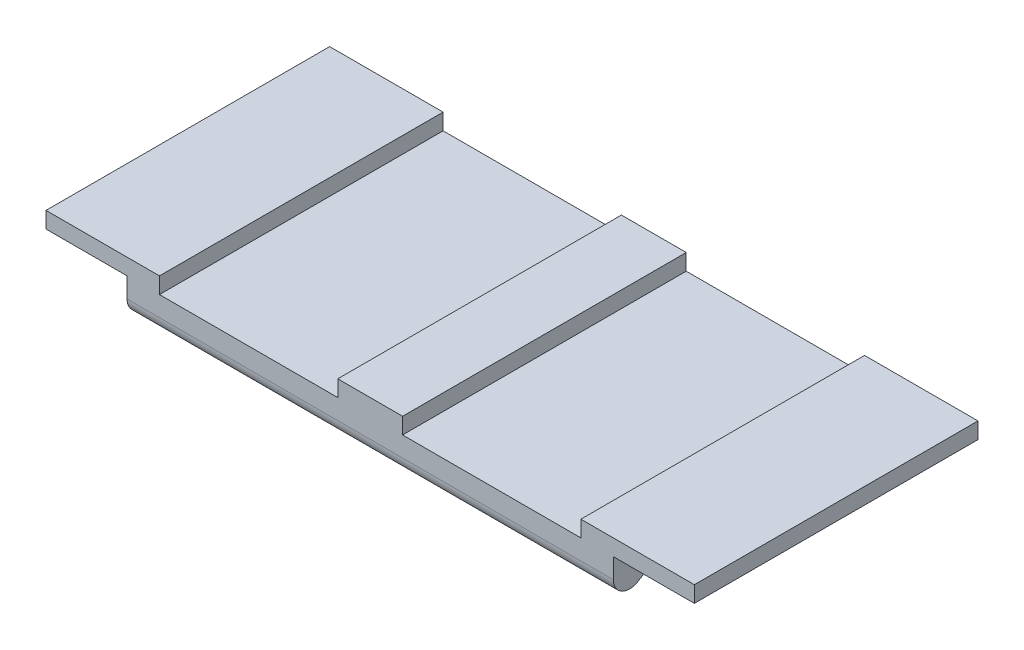
from build123d import *

# Parameters (mm, degrees)
SKETCH1_W               = 60
SKETCH1_H               = 35
BOSS_EXTRUDE1_DEPTH     = 8
CUT_EXTRUDE1_DEPTH      = 64.009919854
CUT_EXTRUDE1_DEPTH_BACK = 64.009919854
FILLET1_R               = 2
SKETCH3_W               = 22
SKETCH3_H               = 2
CUT_EXTRUDE2_DEPTH      = 47.549222321
SKETCH5_W               = 35
SKETCH5_H               = 2
BOSS_EXTRUDE2_DEPTH     = 10


with BuildPart() as part:
    # Sketch1 → Boss-Extrude1 (new body)
    with BuildSketch(Plane(origin=(0, 0, 0), x_dir=(1, 0, 0), z_dir=(0, 1, 0))):
        Rectangle(SKETCH1_W, SKETCH1_H)
    extrude(amount=-BOSS_EXTRUDE1_DEPTH)

    # Sketch2 → Cut-Extrude1 (cut, two sides: drawn at the far end of the back side and taken through both)
    with BuildSketch(Plane(origin=(30, 0, 0), x_dir=(0, 0, -1), z_dir=(1, 0, 0)).offset(-CUT_EXTRUDE1_DEPTH_BACK)):
        Polygon((-12.5, -5), (-17.5, -8), (17.5, -8), (12.5, -5), align=None)
    extrude(amount=CUT_EXTRUDE1_DEPTH + CUT_EXTRUDE1_DEPTH_BACK, mode=Mode.SUBTRACT)

    # Fillet1
    fillet1_edges = [part.edges().sort_by_distance(p)[0] for p in [
        (0, -5, 12.5),
        (0, -5, -12.5),
        (0, -8, -17.5),
        (0, -8, 17.5),
    ]]
    fillet(fillet1_edges, radius=FILLET1_R)

    # Sketch3 → Cut-Extrude2 (cut, through all)
    with BuildSketch(Plane.XY.offset(17.5)):
        with Locations((-15, -1)):
            Rectangle(SKETCH3_W, SKETCH3_H)
        with Locations((15, -1)):
            Rectangle(SKETCH3_W, SKETCH3_H)
    extrude(amount=-CUT_EXTRUDE2_DEPTH, mode=Mode.SUBTRACT)

    # Sketch5 → Boss-Extrude2 (add)
    with BuildSketch(Plane.ZY.offset(30)):
        with Locations((0, -1)):
            Rectangle(SKETCH5_W, SKETCH5_H)
    boss_extrude2 = extrude(amount=BOSS_EXTRUDE2_DEPTH)

    # Mirror1: Boss-Extrude2 across plane
    add(boss_extrude2.mirror(Plane(origin=(0, 0, 0), x_dir=(0, 0, 1), z_dir=(1, 0, 0))))


solid = part.part
